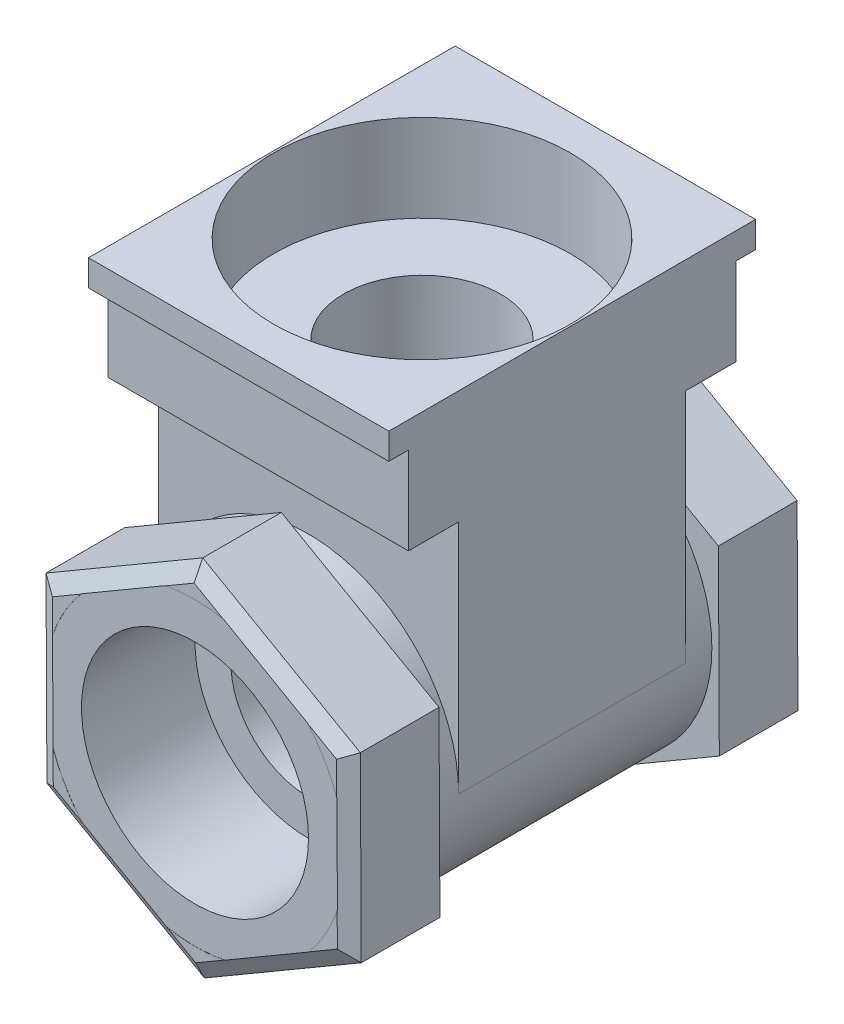
from build123d import *
from build123d.topology import SkipClean

# Parameters (mm, degrees)
SKETCH2_R                = 17.199960221
SKETCH2_R_2              = 12.422193493
SKETCH2_R_3              = 8.504424776
BOSS_EXTRUDE2_DEPTH      = 52
SKETCH4_R                = 13
CUT_EXTRUDE1_DEPTH       = 13
CUT_EXTRUDE2_START       = -13
SKETCH5_R                = 13
CUT_EXTRUDE2_DEPTH       = 13
SKETCH6_R                = 8.9
CUT_EXTRUDE3_DEPTH       = 59.45373069
CUT_EXTRUDE4_DEPTH       = 5
CUT_EXTRUDE5_START       = -5
CUT_EXTRUDE5_DEPTH       = 5
CUT_EXTRUDE6_START       = -2.25
CUT_EXTRUDE6_DEPTH       = 2.25
CUT_EXTRUDE7_DEPTH       = 2.25
CUT_EXTRUDE9_START       = -5.75
CUT_EXTRUDE9_DEPTH       = 5.75
CUT_EXTRUDE10_DEPTH      = 5.75
BOSS_EXTRUDE3_DEPTH      = 0.01
BOSS_EXTRUDE3_DEPTH_BACK = 10
SKETCH13_R               = 17.199960221
BOSS_EXTRUDE4_DEPTH      = 0.01
BOSS_EXTRUDE4_DEPTH_BACK = 10
SKETCH15_R               = 17.199960221
SKETCH16_R               = 17
CUT_EXTRUDE11_DEPTH      = 10
SKETCH17_R               = 9
CUT_EXTRUDE12_DEPTH      = 40
CHAMFER3_SIZE            = 1
CHAMFER3_SIZE_2          = 1.732050808


with BuildPart() as part:
    # Sketch2 → Boss-Extrude2 (new body)
    # profile 1 of 3: a face of its own
    with BuildSketch(Plane.XY):
        with BuildLine():
            Line((17.199960221, 40), (-17.199960221, 40))
            Line((-17.199960221, 40), (-17.199960221, 0))
            ThreePointArc((-17.199960221, 0), (0, 17.199960221), (17.199960221, 0))
            Line((17.199960221, 0), (17.199960221, 40))
        make_face()
    # profile 2 of 3: a face of its own
    with BuildSketch(Plane.XY):
        Circle(SKETCH2_R)
        Circle(SKETCH2_R_2, mode=Mode.SUBTRACT)
    # profile 3 of 3: a face of its own
    with BuildSketch(Plane.XY):
        Circle(SKETCH2_R_2)
        with Locations(Location((0, 0, 0), (0, 0, 180))):
            Circle(SKETCH2_R_3, mode=Mode.SUBTRACT)
    extrude(amount=BOSS_EXTRUDE2_DEPTH)

    # Sketch4 → Cut-Extrude1 (cut)
    with BuildSketch(Plane(origin=(0, 0, 0), x_dir=(-1, 0, 0), z_dir=(0, 0, -1))):
        Circle(SKETCH4_R)
    extrude(amount=-CUT_EXTRUDE1_DEPTH, mode=Mode.SUBTRACT)

    # Sketch5 → Cut-Extrude2 (cut)
    with BuildSketch(Plane.XY.offset(52).offset(CUT_EXTRUDE2_START)):
        with Locations(Location((0, 0, 0), (0, 0, 180))):
            Circle(SKETCH5_R)
    extrude(amount=CUT_EXTRUDE2_DEPTH, mode=Mode.SUBTRACT)

    # Sketch6 → Cut-Extrude3 (cut, through all)
    with BuildSketch(Plane.XY.offset(39)):
        Circle(SKETCH6_R)
    extrude(amount=-CUT_EXTRUDE3_DEPTH, mode=Mode.SUBTRACT)

    # Sketch7 → Cut-Extrude4 (cut)
    with BuildSketch(Plane(origin=(0, 0, 0), x_dir=(-1, 0, 0), z_dir=(0, 0, -1))):
        with BuildLine():
            Line((-17.199960221, 0), (-17.199960221, 40))
            Line((-17.199960221, 40), (17.199960221, 40))
            Line((17.199960221, 40), (17.199960221, 0))
            ThreePointArc((17.199960221, 0), (0, 17.199960221), (-17.199960221, 0))
        make_face()
    extrude(amount=-CUT_EXTRUDE4_DEPTH, mode=Mode.SUBTRACT)

    # Sketch8 → Cut-Extrude5 (cut)
    with BuildSketch(Plane.XY.offset(52).offset(CUT_EXTRUDE5_START)):
        with BuildLine():
            Line((-17.199960221, 0), (-17.199960221, 40))
            Line((-17.199960221, 40), (17.199960221, 40))
            Line((17.199960221, 40), (17.199960221, 0))
            ThreePointArc((17.199960221, 0), (0, 17.199960221), (-17.199960221, 0))
        make_face()
    extrude(amount=CUT_EXTRUDE5_DEPTH, mode=Mode.SUBTRACT)

    # Sketch9 → Cut-Extrude6 (cut)
    with BuildSketch(Plane.XY.offset(47).offset(CUT_EXTRUDE6_START)):
        with BuildLine():
            Line((-17.199960221, 37), (17.199960221, 37))
            Line((17.199960221, 37), (17.199960221, 0))
            ThreePointArc((17.199960221, 0), (0, 17.199960221), (-17.199960221, 0))
            Line((-17.199960221, 0), (-17.199960221, 37))
        make_face()
    extrude(amount=CUT_EXTRUDE6_DEPTH, mode=Mode.SUBTRACT)

    # Sketch10 → Cut-Extrude7 (cut)
    with SkipClean():  # the faces are left unmerged after this step: merging them gives an invalid solid
        with BuildSketch(Plane(origin=(0, 0, 5), x_dir=(-1, 0, 0), z_dir=(0, 0, -1))):
            with BuildLine():
                Line((-17.199960221, 37), (17.199960221, 37))
                Line((17.199960221, 37), (17.199960221, 0))
                ThreePointArc((17.199960221, 0), (0, 17.199960221), (-17.199960221, 0))
                Line((-17.199960221, 0), (-17.199960221, 37))
            make_face()
        extrude(amount=-CUT_EXTRUDE7_DEPTH, mode=Mode.SUBTRACT)
    add(part.part.scale(1), mode=Mode.REPLACE)  # the faces are merged on a copy

    # Sketch11 → Cut-Extrude9 (cut)
    with BuildSketch(Plane.XY.offset(44.75).offset(CUT_EXTRUDE9_START)):
        with BuildLine():
            Line((-17.199960221, 27), (17.199960221, 27))
            Line((17.199960221, 27), (17.199960221, 0))
            ThreePointArc((17.199960221, 0), (0, 17.199960221), (-17.199960221, 0))
            Line((-17.199960221, 0), (-17.199960221, 27))
        make_face()
    extrude(amount=CUT_EXTRUDE9_DEPTH, mode=Mode.SUBTRACT)

    # Sketch12 → Cut-Extrude10 (cut)
    with BuildSketch(Plane(origin=(0, 0, 7.25), x_dir=(-1, 0, 0), z_dir=(0, 0, -1))):
        with BuildLine():
            Line((-17.199960221, 27), (17.199960221, 27))
            Line((17.199960221, 27), (17.199960221, 0))
            ThreePointArc((17.199960221, 0), (0, 17.199960221), (-17.199960221, 0))
            Line((-17.199960221, 0), (-17.199960221, 27))
        make_face()
    extrude(amount=-CUT_EXTRUDE10_DEPTH, mode=Mode.SUBTRACT)

    # Sketch13 → Boss-Extrude3 (add, two sides: drawn at the far end of the back side and taken through both)
    with BuildSketch(Plane(origin=(0, 0, 0), x_dir=(-1, 0, 0), z_dir=(0, 0, -1)).offset(-BOSS_EXTRUDE3_DEPTH_BACK)):
        Polygon((-0.103617408, -20.784351408), (17.947967616, -10.481911012), (18.051585024, 10.302440396), (0.103617408, 20.784351408), (0, 20.725214652), (-17.947967616, 10.481911012), (-18.051585024, -10.302440396), align=None)
        Circle(SKETCH13_R, mode=Mode.SUBTRACT)
    extrude(amount=BOSS_EXTRUDE3_DEPTH + BOSS_EXTRUDE3_DEPTH_BACK)

    # Sketch15 → Boss-Extrude4 (add, two sides: drawn at the far end of the back side and taken through both)
    with BuildSketch(Plane.XY.offset(52).offset(-BOSS_EXTRUDE4_DEPTH_BACK)):
        Polygon((-18.051585024, 10.302440396), (-17.947967616, -10.481911012), (0.103617408, -20.784351408), (18.051585024, -10.302440396), (17.947967616, 10.481911012), (-0.103617408, 20.784351408), align=None)
        with Locations(Location((0, 0, 0), (0, 0, 180))):
            Circle(SKETCH15_R, mode=Mode.SUBTRACT)
    extrude(amount=BOSS_EXTRUDE4_DEPTH + BOSS_EXTRUDE4_DEPTH_BACK)

    # Sketch16 → Cut-Extrude11 (cut)
    with BuildSketch(Plane(origin=(0, 40, 0), x_dir=(1, 0, 0), z_dir=(0, 1, 0))):
        with Locations(Location((0, -26, 0), (0, 0, 270))):
            Circle(SKETCH16_R)
    extrude(amount=-CUT_EXTRUDE11_DEPTH, mode=Mode.SUBTRACT)

    # Sketch17 → Cut-Extrude12 (cut)
    with BuildSketch(Plane(origin=(0, 30, 0), x_dir=(1, 0, 0), z_dir=(0, 1, 0))):
        with Locations(Location((0, -26, 0), (0, 0, 270))):
            Circle(SKETCH17_R)
    extrude(amount=-CUT_EXTRUDE12_DEPTH, mode=Mode.SUBTRACT)

    # Chamfer3
    # the kernel refuses this chamfer: 1.732050808, 1 mm, written as the material it takes off along each edge
    with BuildSketch(Plane(origin=(21.92099597, -8.042640174, -0.01), x_dir=(0.029196521986656933, -0.04999262353370063, 0.9983227437537924), z_dir=(-0.8635219945420718, -0.5043111786804675, 0)), Plane(origin=(3.99536728, -23.005459473, -0.01), x_dir=(-0.028696620988686708, -0.050281241509443776, 0.9983227437537926), z_dir=(-0.8685072894207939, 0.4956763946598076, 0)), Plane(origin=(-17.925628689, -14.962819299, -0.01), x_dir=(-0.05789314297534289, -0.0002886179757454726, 0.9983227437537926), z_dir=(-0.004985294878722003, 0.9999875733402752, 0)), Plane(origin=(-21.92099597, 8.042640174, -0.01), x_dir=(-0.029196521986655326, 0.04999262353369786, 0.9983227437537926), z_dir=(0.8635219945420716, 0.5043111786804677, 0)), Plane(origin=(17.925628689, 14.962819299, -0.01), x_dir=(0.05789314297534289, 0.0002886179757454726, 0.9983227437537926), z_dir=(0.004985294878722003, -0.9999875733402752, 0)), Plane(origin=(-18.073923951, 14.783348683, 52.01), x_dir=(-0.05789314297534298, -0.00028861797574591844, -0.9983227437537926), z_dir=(0.004985294878729695, -0.9999875733402751, 0)), Plane(origin=(-21.839717488, -8.260802946, 52.01), x_dir=(-0.028696620988686607, -0.05028124150944443, -0.9983227437537926), z_dir=(0.8685072894207975, -0.49567639465980146, 0)), Plane(origin=(-3.765793537, -23.044151629, 52.01), x_dir=(0.02919652198665585, -0.04999262353369789, -0.9983227437537927), z_dir=(0.8635219945420678, 0.5043111786804741, 0)), Plane(origin=(18.073923951, -14.783348683, 52.01), x_dir=(0.057893142975342975, 0.00028861797574592825, -0.9983227437537926), z_dir=(-0.004985294878729864, 0.9999875733402751, 0)), Plane(origin=(21.839717488, 8.260802946, 52.01), x_dir=(0.02869662098868756, 0.050281241509446094, -0.9983227437537926), z_dir=(-0.8685072894207974, 0.4956763946598015, 0)), Plane(origin=(3.765793537, 23.044151629, 52.01), x_dir=(-0.029196521986655923, 0.04999262353369809, -0.9983227437537926), z_dir=(-0.8635219945420681, -0.5043111786804736, 0))) as chamfer3_piece_1:
        Polygon((CHAMFER3_SIZE * 0.998322743754, CHAMFER3_SIZE * 0.0578938624027), (-CHAMFER3_SIZE_2 * 0.0578938623883, CHAMFER3_SIZE_2 * 0.998322743505), (0, 0), align=None)
    extrude(amount=29.746537632, mode=Mode.SUBTRACT)
    with BuildSketch(Plane(origin=(21.839717488, 8.260802946, -0.01), x_dir=(0.02869662098868796, 0.05028124150944598, 0.9983227437537924), z_dir=(-0.8685072894207939, 0.4956763946598075, 0))) as chamfer3_piece_2:
        Polygon((CHAMFER3_SIZE * 0.998322743754, -CHAMFER3_SIZE * 0.0578938624027), (-CHAMFER3_SIZE_2 * 0.0578938623883, -CHAMFER3_SIZE_2 * 0.998322743505), (0, 0), align=None)
    extrude(amount=29.746537632, mode=Mode.SUBTRACT)


solid = part.part
